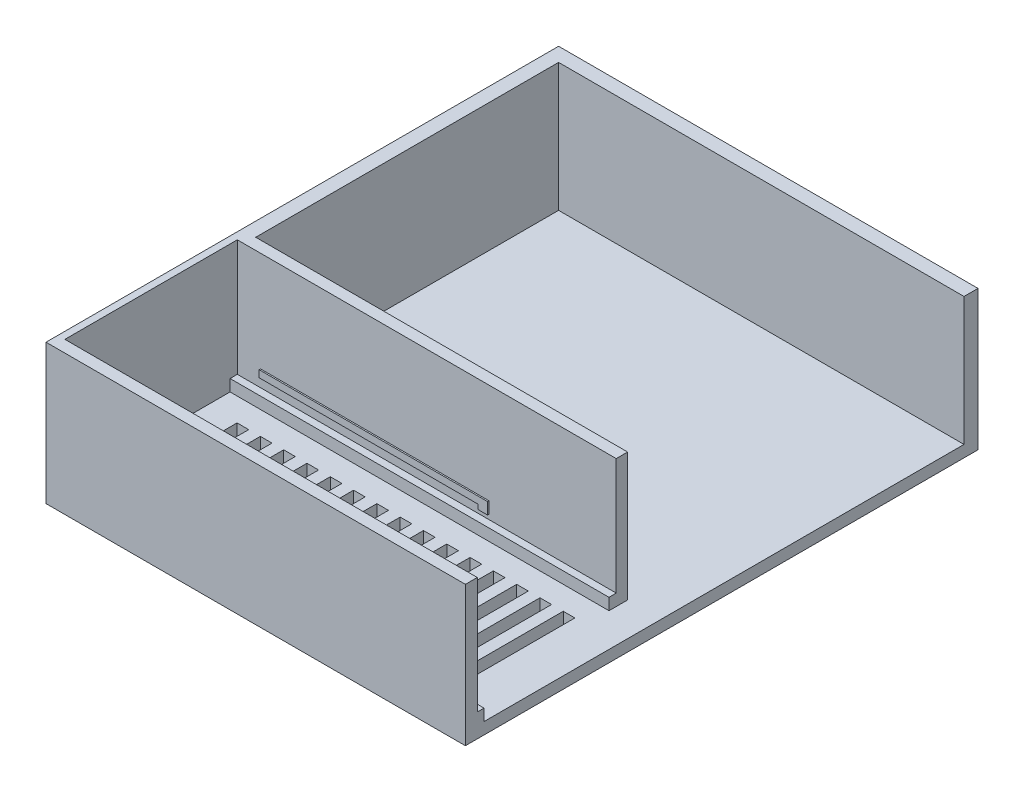
from build123d import *

# Parameters (mm, degrees)
SKETCH1_W           = 90
SKETCH1_H           = 110
SKETCH1_W_2         = 2.5
SKETCH1_H_2         = 25
BOSS_EXTRUDE1_DEPTH = 2.5
BOSS_EXTRUDE2_DEPTH = 2.5
BOSS_EXTRUDE3_DEPTH = 25
BOSS_EXTRUDE4_DEPTH = 0.3
BOSS_EXTRUDE5_DEPTH = 0.3


with BuildPart() as part:
    # Sketch1 → Boss-Extrude1 (new body)
    with BuildSketch(Plane(origin=(0, 0, 0), x_dir=(1, 0, 0), z_dir=(0, 1, 0))):
        Rectangle(SKETCH1_W, SKETCH1_H)
        with Locations((-30.75, -34.5)):
            Rectangle(SKETCH1_W_2, SKETCH1_H_2, mode=Mode.SUBTRACT)
        with Locations((-35.75, -34.5)):
            Rectangle(SKETCH1_W_2, SKETCH1_H_2, mode=Mode.SUBTRACT)
        with Locations((-25.75, -34.5)):
            Rectangle(SKETCH1_W_2, SKETCH1_H_2, mode=Mode.SUBTRACT)
        with Locations((-20.75, -34.5)):
            Rectangle(SKETCH1_W_2, SKETCH1_H_2, mode=Mode.SUBTRACT)
        with Locations((-15.75, -34.5)):
            Rectangle(SKETCH1_W_2, SKETCH1_H_2, mode=Mode.SUBTRACT)
        with Locations((-10.75, -34.5)):
            Rectangle(SKETCH1_W_2, SKETCH1_H_2, mode=Mode.SUBTRACT)
        with Locations((-5.75, -34.5)):
            Rectangle(SKETCH1_W_2, SKETCH1_H_2, mode=Mode.SUBTRACT)
        with Locations((-0.75, -34.5)):
            Rectangle(SKETCH1_W_2, SKETCH1_H_2, mode=Mode.SUBTRACT)
        with Locations((4.25, -34.5)):
            Rectangle(SKETCH1_W_2, SKETCH1_H_2, mode=Mode.SUBTRACT)
        with Locations((9.25, -34.5)):
            Rectangle(SKETCH1_W_2, SKETCH1_H_2, mode=Mode.SUBTRACT)
        with Locations((14.25, -34.5)):
            Rectangle(SKETCH1_W_2, SKETCH1_H_2, mode=Mode.SUBTRACT)
        with Locations((19.25, -34.5)):
            Rectangle(SKETCH1_W_2, SKETCH1_H_2, mode=Mode.SUBTRACT)
        with Locations((24.25, -34.5)):
            Rectangle(SKETCH1_W_2, SKETCH1_H_2, mode=Mode.SUBTRACT)
        with Locations((29.25, -34.5)):
            Rectangle(SKETCH1_W_2, SKETCH1_H_2, mode=Mode.SUBTRACT)
        with Locations((34.25, -34.5)):
            Rectangle(SKETCH1_W_2, SKETCH1_H_2, mode=Mode.SUBTRACT)
    extrude(amount=BOSS_EXTRUDE1_DEPTH)

    # Sketch2 → Boss-Extrude2 (add)
    with BuildSketch(Plane(origin=(0, 2.5, 0), x_dir=(1, 0, 0), z_dir=(0, 1, 0))):
        Polygon((45, -55), (45, -51.672973313), (45, -51), (-43.5, -51), (-43.5, -17), (37.81362096, -17), (37.81362096, -13), (-42, -13), (-42, 52), (45, 52), (45, 55), (-45, 55), (-45, -55), align=None)
    extrude(amount=BOSS_EXTRUDE2_DEPTH)

    # Sketch4 → Boss-Extrude3 (add)
    with BuildSketch(Plane(origin=(0, 5, 0), x_dir=(1, 0, 0), z_dir=(0, 1, 0))):
        Polygon((-43.5, -51), (-43.5, -52.44761927), (45, -52.44761927), (45, -55), (-45, -55), (-45, 55), (45, 55), (45, 52), (-42, 52), (-42, -13), (37.81362096, -13), (37.81362096, -15.444661874), (-43.5, -15.444661874), (-43.5, -17), align=None)
    extrude(amount=BOSS_EXTRUDE3_DEPTH)

    # Sketch5 → Boss-Extrude4 (add)
    with BuildSketch(Plane(origin=(0, 0, 52.44761927), x_dir=(-1, 0, 0), z_dir=(0, 0, -1))):
        Polygon((38.5, 8.5), (-10.5, 8.5), (-10.5, 7), (-10.5, 6), (-8.5, 6), (-8.5, 7), (38.5, 7), align=None)
    extrude(amount=BOSS_EXTRUDE4_DEPTH)

    # Sketch7 → Boss-Extrude5 (add)
    with BuildSketch(Plane.XY.offset(15.444661874)):
        Polygon((10.5, 8.5), (10.5, 6), (8.5, 6), (8.5, 7), (-38.5, 7), (-38.5, 8.5), align=None)
    extrude(amount=BOSS_EXTRUDE5_DEPTH)


solid = part.part
